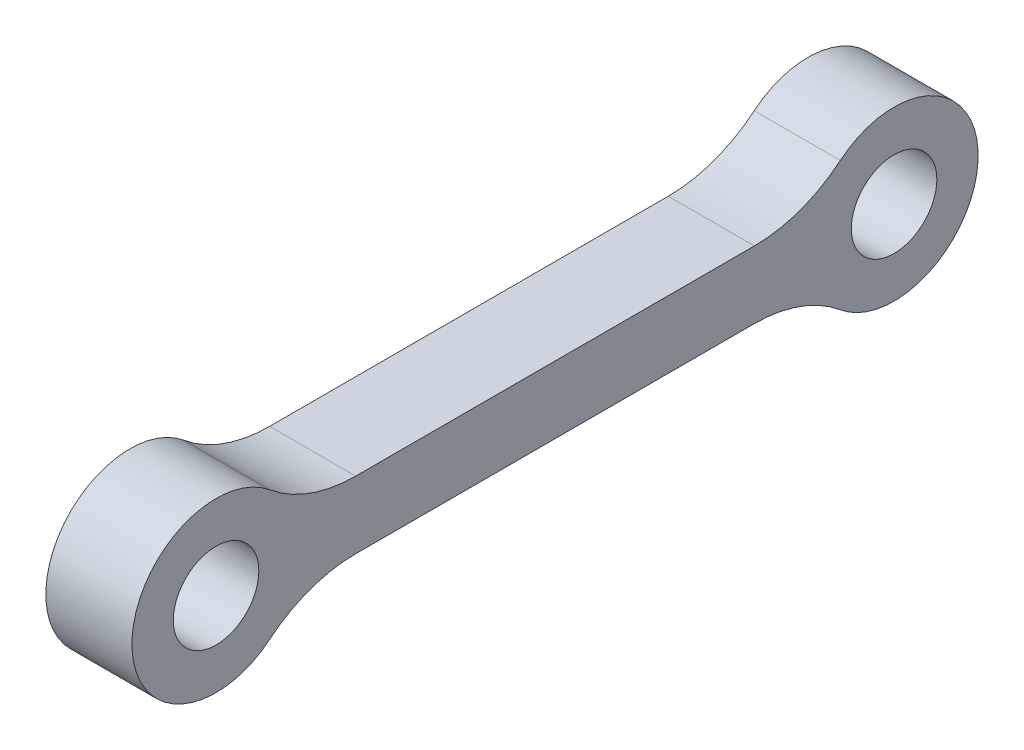
from build123d import *

# Parameters (mm, degrees)
SKETCH1_R           = 2.0193
BOSS_EXTRUDE1_DEPTH = 4.064
FILLET1_R           = 6.35


with BuildPart() as part:
    # Sketch1 → Boss-Extrude1 (new body)
    with BuildSketch(Plane(origin=(0, 0, 0), x_dir=(0, 0, -1), z_dir=(1, 0, 0))):
        with BuildLine():
            Line((3.637419458, 1.5875), (28.362580542, 1.5875))
            ThreePointArc((28.362580542, 1.5875), (35.96875, 0), (28.362580542, -1.5875))
            Line((28.362580542, -1.5875), (3.637419458, -1.5875))
            ThreePointArc((3.637419458, -1.5875), (-3.96875, 0), (3.637419458, 1.5875))
        make_face()
        Circle(SKETCH1_R, mode=Mode.SUBTRACT)
        with Locations((32, 0)):
            Circle(SKETCH1_R, mode=Mode.SUBTRACT)
    extrude(amount=BOSS_EXTRUDE1_DEPTH)

    # Fillet1
    fillet1_edges = [part.edges().sort_by_distance(p)[0] for p in [
        (2.032, 1.5875, -28.362580542),
        (2.032, -1.5875, -28.362580542),
        (2.032, -1.5875, -3.637419458),
        (2.032, 1.5875, -3.637419458),
    ]]
    fillet(fillet1_edges, radius=FILLET1_R)


solid = part.part
